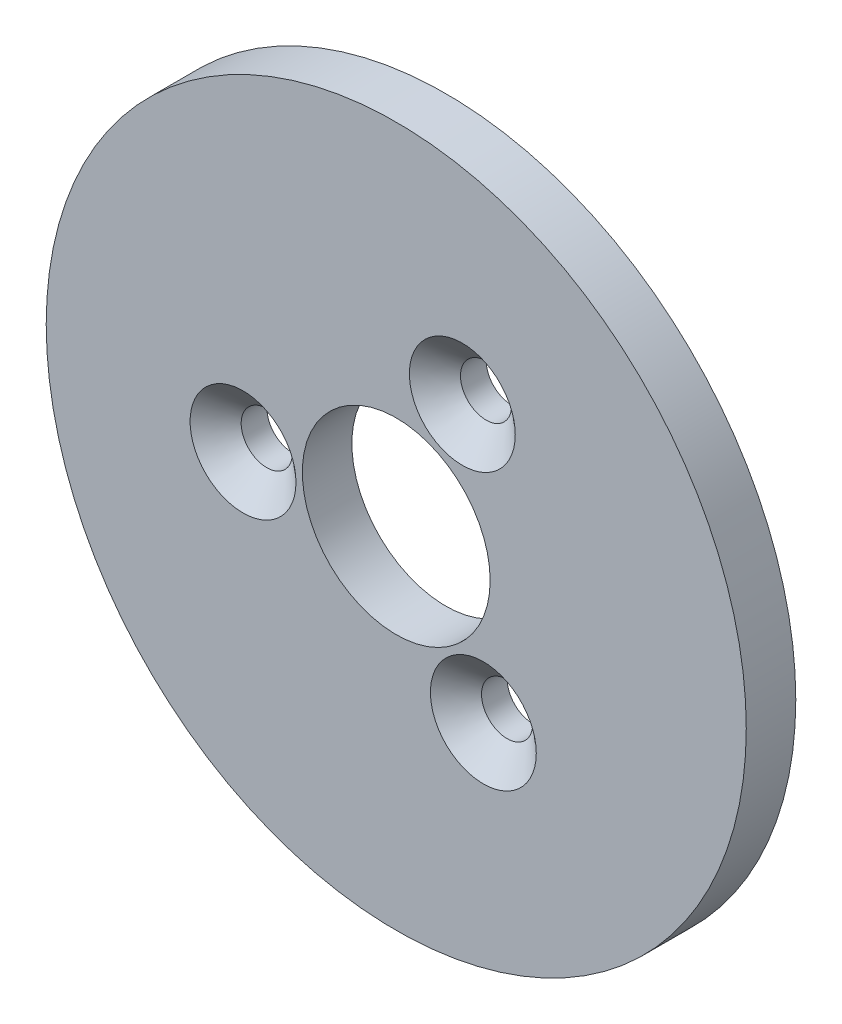
from build123d import *

# Parameters (mm, degrees)
SKETCH1_R           = 20.5
BOSS_EXTRUDE1_DEPTH = 2.9
SKETCH2_R           = 1.5
CUT_EXTRUDE1_DEPTH  = 30.136060132
CHAMFER1_SIZE       = 1.6
CHAMFER1_SIZE2      = 1.390858781
SKETCH3_R           = 5.5
CUT_EXTRUDE2_DEPTH  = 30.136060132


with BuildPart() as part:
    # Sketch1 → Boss-Extrude1 (new body)
    with BuildSketch(Plane.XY):
        Circle(SKETCH1_R)
    extrude(amount=BOSS_EXTRUDE1_DEPTH)

    # Sketch2 → Cut-Extrude1 (cut, through all)
    with BuildSketch(Plane.XY.offset(2.9)):
        with Locations((-8.971859678, -0.711149714)):
            Circle(SKETCH2_R)
        with Locations((5.101803557, -7.414283544)):
            Circle(SKETCH2_R)
        with Locations((3.870056121, 8.125433257)):
            Circle(SKETCH2_R)
    extrude(amount=-CUT_EXTRUDE1_DEPTH, mode=Mode.SUBTRACT)

    # Chamfer1
    chamfer1_edges = [part.edges().sort_by_distance(p)[0] for p in [
        (-10.471859678, -0.711149714, 2.9),
        (2.370056121, 8.125433257, 2.9),
        (3.601803557, -7.414283544, 2.9),
    ]]
    chamfer1_side = [part.faces().sort_by_distance(p)[0] for p in [
        (0, 0, 2.9),
    ]]
    chamfer(chamfer1_edges, length=CHAMFER1_SIZE, length2=CHAMFER1_SIZE2, reference=chamfer1_side[0])

    # Sketch3 → Cut-Extrude2 (cut, through all)
    with BuildSketch(Plane.XY.offset(2.9)):
        Circle(SKETCH3_R)
    extrude(amount=-CUT_EXTRUDE2_DEPTH, mode=Mode.SUBTRACT)


solid = part.part
